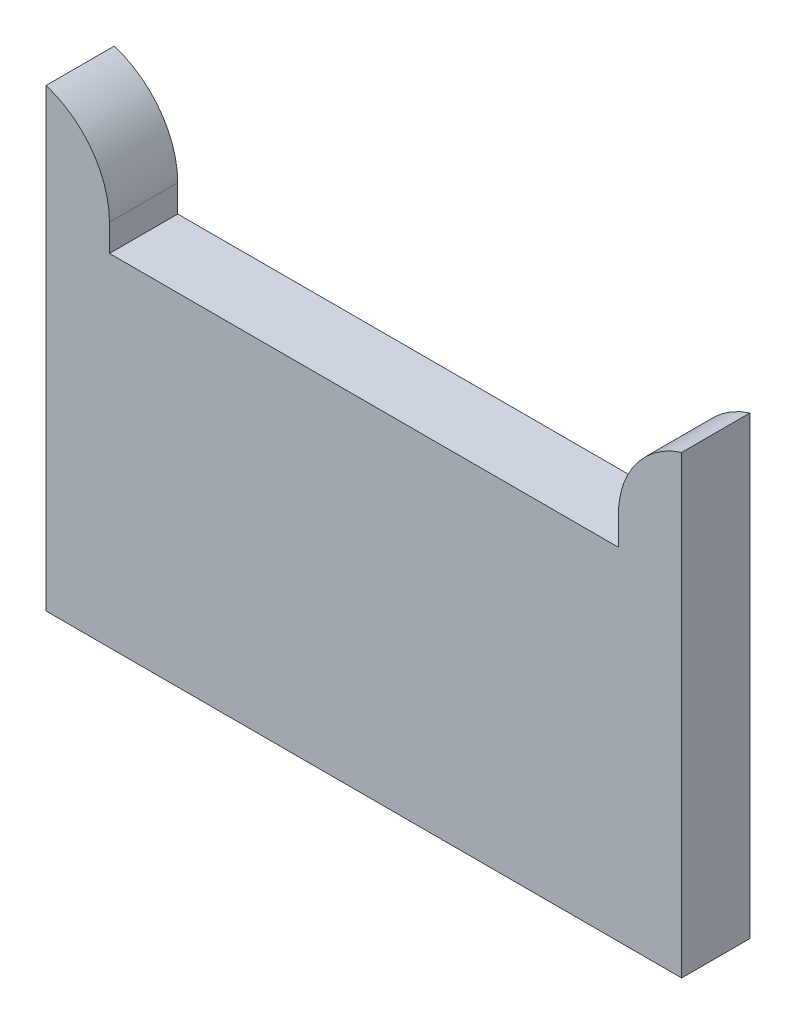
from build123d import *

# Parameters (mm, degrees)
BOSS_EXTRUDE1_DEPTH = 6
FILLET7_R           = 8
FILLET8_R           = 8


with BuildPart() as part:
    # Sketch1 → Boss-Extrude1 (new body)
    with BuildSketch(Plane.XY):
        Polygon((-27.927868544, -36.616915423), (27.927868544, -36.616915423), (27.927868544, 3.383084577), (22.35572924, 3.383084577), (22.35572924, -6.616915423), (-22.35572924, -6.616915423), (-22.35572924, 3.383084577), (-27.927868544, 3.383084577), align=None)
    extrude(amount=BOSS_EXTRUDE1_DEPTH)

    # Fillet7
    # the kernel refuses this fillet: 8 mm, written as the material it takes off along each edge
    with BuildSketch(Plane(origin=(-22.35572924, 3.383084577, -19.056739693), x_dir=(0, -1, 0), z_dir=(0, 0, 1))) as fillet7_piece_1:
        with BuildLine():
            CenterArc((7.622695877, -8), FILLET7_R, 90, 72.333104018)
            Line((0, -5.572139303), (-0.152453918, -5.52358209))
            ThreePointArc((-0.152453918, -5.52358209), (-0.16, -2.786069652), (-0.16, 0))
            Line((-0.16, 0), (0, 0.16))
            Line((0, 0.16), (7.622695877, 0.16))
            Line((7.622695877, 0.16), (7.622695877, 0))
        make_face()
    extrude(amount=44.113479387, mode=Mode.SUBTRACT)

    # Fillet8
    # the kernel refuses this fillet: 8 mm, written as the material it takes off along each edge
    with BuildSketch(Plane(origin=(22.35572924, 3.383084577, -19.056739693), x_dir=(1, 0, 0), z_dir=(0, 0, 1))) as fillet8_piece_1:
        with BuildLine():
            CenterArc((8, -7.622695877), FILLET8_R, 107.666895982, 72.333104018)
            Line((0, -7.622695877), (-0.16, -7.622695877))
            Line((-0.16, -7.622695877), (-0.16, 0))
            Line((-0.16, 0), (0, 0.16))
            ThreePointArc((0, 0.16), (2.786069652, 0.16), (5.52358209, 0.152453918))
            Line((5.52358209, 0.152453918), (5.572139303, 0))
        make_face()
    extrude(amount=44.113479387, mode=Mode.SUBTRACT)


solid = part.part
